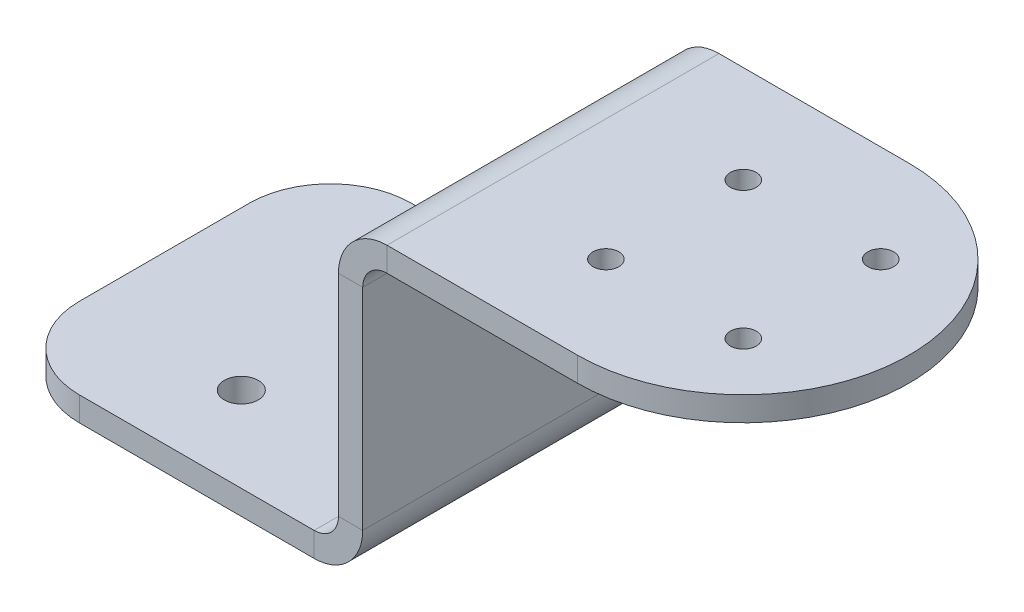
from build123d import *

# Parameters (mm, degrees)
EXTRUDE_THIN1_DEPTH    = 41
CONVERT_SOLID1_DEPTH   = 41
CONVERT_SOLID1_2_DEPTH = 41
SKETCH6_R              = 1.6
CUT_EXTRUDE1_DEPTH     = 3
M5X0_8_TAPPED_HOLE1_D  = 4.2
FILLET1_R              = 10


# Read off the part's stored shape, not the designer's step: Convert-Solid1
with BuildPart() as part:
    # Sketch1 → Extrude-Thin1 (new body)
    with BuildSketch(Plane.XY):
        Polygon((50, 35), (0, 35), (0, 0), (-45, 0), (-45, 3), (-3, 3), (-3, 38), (50, 38), align=None)
    extrude(amount=EXTRUDE_THIN1_DEPTH)

    # Convert-Solid1 outline → Convert-Solid1 (cut)
    with BuildSketch(Plane.XY):
        with BuildLine():
            Line((-3, 38), (-3, 32))
            ThreePointArc((-3, 32), (-1.242640687, 36.242640687), (3, 38))
            Line((3, 38), (-3, 38))
        make_face()
        with BuildLine():
            Line((0, 0), (0, 6))
            ThreePointArc((0, 6), (-1.757359313, 1.757359313), (-6, 0))
            Line((-6, 0), (0, 0))
        make_face()
    extrude(amount=CONVERT_SOLID1_DEPTH, mode=Mode.SUBTRACT)

    # Convert-Solid1 2 outline → Convert-Solid1 2 (add)
    with BuildSketch(Plane.XY):
        with BuildLine():
            Line((-3, 3), (-3, 6))
            ThreePointArc((-3, 6), (-3.878679656, 3.878679656), (-6, 3))
            Line((-6, 3), (-3, 3))
        make_face()
        with BuildLine():
            Line((0, 35), (0, 32))
            ThreePointArc((0, 32), (0.878679656, 34.121320344), (3, 35))
            Line((3, 35), (0, 35))
        make_face()
    extrude(amount=CONVERT_SOLID1_2_DEPTH)

    # Sketch6 → Cut-Extrude1 (cut)
    with BuildSketch(Plane(origin=(0, 38, 0), x_dir=(1, 0, 0), z_dir=(0, 1, 0))):
        with Locations(Location((34.985281374, -12.014718626, 0), (0, 0, 270))):
            Circle(SKETCH6_R)
        with Locations(Location((34.985281374, -28.985281374, 0), (0, 0, 270))):
            Circle(SKETCH6_R)
        with Locations(Location((18.014718626, -28.985281374, 0), (0, 0, 270))):
            Circle(SKETCH6_R)
        with Locations(Location((18.014718626, -12.014718626, 0), (0, 0, 270))):
            Circle(SKETCH6_R)
        with BuildLine():
            Line((51.105144577, 0), (51.105144577, -41))
            Line((51.105144577, -41), (26.5, -41))
            ThreePointArc((26.5, -41), (47, -20.5), (26.5, 0))
            Line((26.5, 0), (51.105144577, 0))
        make_face()
    extrude(amount=-CUT_EXTRUDE1_DEPTH, mode=Mode.SUBTRACT)

    # M5x0.8 Tapped Hole1 (through all)
    with Locations(Plane(origin=(0, 3, 0), x_dir=(1, 0, 0), z_dir=(0, 1, 0))):
        with Locations((-25.5, -30.5), (-25.5, -10.5)):
            Hole(M5X0_8_TAPPED_HOLE1_D / 2)

    # Fillet1
    fillet1_edges = [part.edges().sort_by_distance(p)[0] for p in [
        (-45, 1.5, 41),
        (-45, 1.5, 0),
    ]]
    fillet(fillet1_edges, radius=FILLET1_R)


solid = part.part
